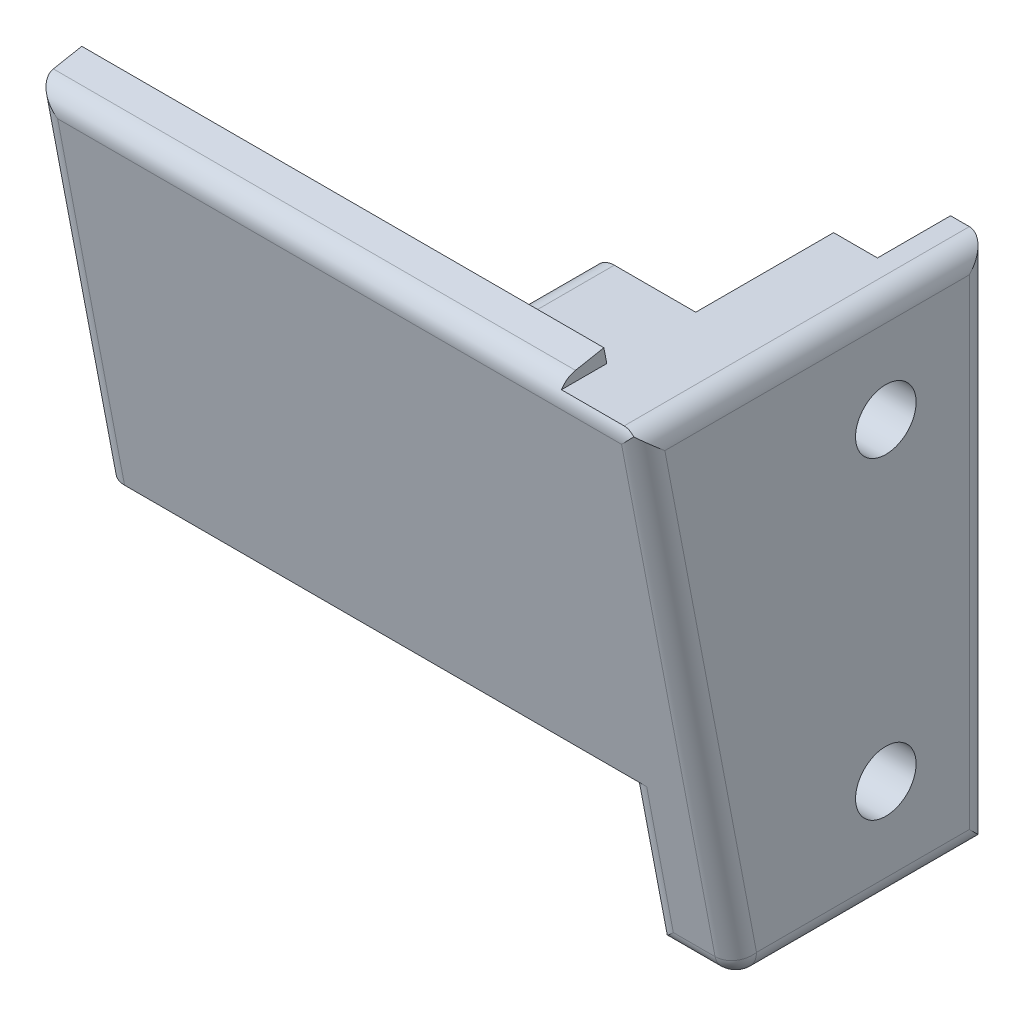
from build123d import *

# Parameters (mm, degrees)
EXTRUDE_1_DEPTH      = 50
SKETCH_2_W           = 50
SKETCH_2_H           = 10
EXTRUDE_2_DEPTH      = 10
SKETCH_3_W           = 10
SKETCH_3_H           = 20
EXTRUDE_3_DEPTH      = 20
SKETCH_4_W           = 20
SKETCH_4_H           = 10
EXTRUDE_4_DEPTH      = 30
CUT_EXTRUDE_1_DEPTH  = 50
CHAMFER_1_SIZE       = 2
SKETCH_9_R           = 1.5
CUT_EXTRUDE_2_DEPTH  = 66.715656955
CUT_EXTRUDE_4_DEPTH  = 6
SKETCH_13_W          = 4
SKETCH_13_H          = 6
EXTRUDE_12_DEPTH     = 18.003980276
SKETCH_15_W          = 20
SKETCH_15_H          = 50
SKETCH_15_R          = 1.5
EXTRUDE_14_DEPTH     = 4
CUT_EXTRUDE_5_DEPTH  = 4
SKETCH_17_W          = 20
SKETCH_17_H          = 20
EXTRUDE_15_DEPTH     = 6
SKETCH_18_W          = 50
SKETCH_18_H          = 4
CUT_EXTRUDE_6_DEPTH  = 20
SKETCH_19_W          = 4
SKETCH_19_H          = 4
CUT_EXTRUDE_9_DEPTH  = 18.003980276
EXTRUDE_16_REACH     = 84.488
SKETCH_20_W          = 5
SKETCH_20_H          = 30
EXTRUDE_17_DEPTH     = 18.003980276
SKETCH_22_W          = 60
SKETCH_22_H          = 10
CUT_EXTRUDE_10_DEPTH = 6
SKETCH_23_R          = 1.5
CUT_EXTRUDE_11_DEPTH = 4
CHAMFER_2_SIZE       = 1
SKETCH_24_R          = 3
CUT_EXTRUDE_12_DEPTH = 2
SKETCH_25_W          = 15
SKETCH_25_H          = 50
CUT_EXTRUDE_13_DEPTH = 10
SKETCH_26_W          = 5
SKETCH_26_H          = 50
EXTRUDE_18_DEPTH     = 19
SKETCH_27_W          = 7
SKETCH_27_H          = 50
CUT_EXTRUDE_14_DEPTH = 4.2
EXTRUDE_19_DEPTH     = 3
SKETCH_29_R          = 1.5
CUT_EXTRUDE_15_DEPTH = 13
SKETCH_30_R          = 2.9
CUT_EXTRUDE_16_DEPTH = 6
SKETCH_31_W          = 6
SKETCH_31_H          = 10
CUT_EXTRUDE_17_DEPTH = 10
SKETCH_32_W          = 8
SKETCH_32_H          = 10
EXTRUDE_20_DEPTH     = 6
SKETCH_33_W          = 50
SKETCH_33_H          = 5
CUT_EXTRUDE_18_DEPTH = 6
EXTRUDE_21_REACH     = 80.899
SKETCH_34_W          = 9.8
SKETCH_34_H          = 8.8
CUT_EXTRUDE_19_DEPTH = 3
SKETCH_36_W          = 58
SKETCH_36_H          = 4.873682846
CUT_EXTRUDE_20_DEPTH = 24
SKETCH_37_W          = 8
SKETCH_37_H          = 3
CUT_EXTRUDE_21_DEPTH = 24
FILLET_1_R           = 2
FILLET_2_R           = 2
FILLET_3_R           = 5


with BuildPart() as part:
    # 草图1 → 凸台-拉伸1 (new body)
    with BuildSketch(Plane(origin=(0, 0, 0), x_dir=(0, 0, -1), z_dir=(1, 0, 0))):
        Polygon((0, 0), (-10, 0), (-17.629858184, 40), (-10, 41.455368398), (-4, 10), (0, 10), align=None)
    extrude(amount=EXTRUDE_1_DEPTH)

    # 草图2 → 凸台-拉伸2 (add)
    with BuildSketch(Plane.XZ):
        with Locations((25, 5)):
            Rectangle(SKETCH_2_W, SKETCH_2_H)
    extrude(amount=EXTRUDE_2_DEPTH)

    # 草图3 → 凸台-拉伸3 (add)
    with BuildSketch(Plane.ZY):
        with Locations((5, 0)):
            Rectangle(SKETCH_3_W, SKETCH_3_H)
    extrude(amount=EXTRUDE_3_DEPTH)

    # 草图4 → 凸台-拉伸4 (add)
    with BuildSketch(Plane(origin=(0, 10, 0), x_dir=(1, 0, 0), z_dir=(0, 1, 0))):
        with Locations((-10, -5)):
            Rectangle(SKETCH_4_W, SKETCH_4_H)
    extrude(amount=EXTRUDE_4_DEPTH)

    # 草图5 → 切除-拉伸1 (cut)
    with BuildSketch(Plane(origin=(50, 0, 0), x_dir=(0, 0, -1), z_dir=(1, 0, 0))):
        Polygon((-10, 10.003980276), (-11.908223769, 10.003980276), (-10, 0), align=None)
    extrude(amount=-CUT_EXTRUDE_1_DEPTH, mode=Mode.SUBTRACT)

    # 倒角1
    # the kernel refuses this chamfer: 2 mm, written as the material it adds along each edge
    with BuildSketch(Plane(origin=(50, 10.003980276, 10), x_dir=(0, 0.027495876610586487, 0.9996219169112968), z_dir=(-1, 0, 0))) as chamfer_1_piece_1_section:
        Polygon((CHAMFER_1_SIZE * 0.999621916911, -CHAMFER_1_SIZE * 0.0274958766106), (-CHAMFER_1_SIZE * 0.0274958766106, -CHAMFER_1_SIZE * 0.999621916911), (0, 0), align=None)
    chamfer_1_piece_1 = extrude(amount=50, mode=Mode.PRIVATE)
    chamfer_1_piece_1 = split(chamfer_1_piece_1, bisect_by=Plane(origin=(25, 9.131023425, 11.741710345), z_dir=(0, 0.18736828457892524, -0.9822897362458548)), keep=Keep.TOP, mode=Mode.PRIVATE)
    add(chamfer_1_piece_1)

    # 草图9 → 切除-拉伸2 (cut, through all)
    with BuildSketch(Plane.XY.offset(10)):
        with Locations((-10, 30)):
            Circle(SKETCH_9_R)
        with Locations((-10, 0)):
            Circle(SKETCH_9_R)
    extrude(amount=-CUT_EXTRUDE_2_DEPTH, mode=Mode.SUBTRACT)

    # 草图12 → 切除-拉伸4 (cut)
    with BuildSketch(Plane.XY.offset(10)):
        Polygon((50, -10), (50, 8.003980276), (0, 8.003980276), (0, 40), (-20, 40), (-20, -10), align=None)
    extrude(amount=-CUT_EXTRUDE_4_DEPTH, mode=Mode.SUBTRACT)

    # 草图13 → 凸台-拉伸12 (add)
    with BuildSketch(Plane.XZ.offset(-8.003980276)):
        with Locations((2, 7)):
            Rectangle(SKETCH_13_W, SKETCH_13_H)
        with Locations((48, 7)):
            Rectangle(SKETCH_13_W, SKETCH_13_H)
    extrude(amount=EXTRUDE_12_DEPTH)

    # 草图15 → 凸台-拉伸14 (add)
    with BuildSketch(Plane(origin=(0, 0, 0), x_dir=(-1, 0, 0), z_dir=(0, 0, -1))):
        with Locations((-60, 15)):
            Rectangle(SKETCH_15_W, SKETCH_15_H)
        with Locations(Location((-60, 30, 0), (0, 0, 180))):
            Circle(SKETCH_15_R, mode=Mode.SUBTRACT)
    extrude(amount=-EXTRUDE_14_DEPTH)

    # 草图16 → 切除-拉伸5 (cut)
    with BuildSketch(Plane.XY.offset(4)):
        Polygon((-20, -10), (0, -10), (0, 10), (0, 40), (-20, 40), align=None)
    extrude(amount=-CUT_EXTRUDE_5_DEPTH, mode=Mode.SUBTRACT)

    # 草图17 → 凸台-拉伸15 (add)
    with BuildSketch(Plane.XY.offset(4)):
        with Locations((60, 0)):
            Rectangle(SKETCH_17_W, SKETCH_17_H)
    extrude(amount=EXTRUDE_15_DEPTH)

    # 草图18 → 切除-拉伸6 (cut)
    with BuildSketch(Plane(origin=(0, 10, 0), x_dir=(1, 0, 0), z_dir=(0, 1, 0))):
        with Locations((25, -2)):
            Rectangle(SKETCH_18_W, SKETCH_18_H)
    extrude(amount=-CUT_EXTRUDE_6_DEPTH, mode=Mode.SUBTRACT)

    # 草图19 → 切除-拉伸9 (cut)
    with BuildSketch(Plane.XZ.offset(10)):
        with Locations((48, 8)):
            Rectangle(SKETCH_19_W, SKETCH_19_H)
        with Locations((2, 8)):
            Rectangle(SKETCH_19_W, SKETCH_19_H)
    extrude(amount=-CUT_EXTRUDE_9_DEPTH, mode=Mode.SUBTRACT)

    # 凸台-拉伸16: up to this plane
    extrude_16_end = Plane(origin=(50, 0, 10), z_dir=(0, 0.18736828457892524, -0.9822897362458548))
    # 草图20 → 凸台-拉伸16 (add, up to the surface)
    with BuildSketch(Plane.XY.offset(4), mode=Mode.PRIVATE) as extrude_16_sk1:
        with Locations((52.5, 25)):
            Rectangle(SKETCH_20_W, SKETCH_20_H)
    extrude_16_tool1 = split(extrude(extrude_16_sk1.sketch, amount=EXTRUDE_16_REACH, mode=Mode.PRIVATE), bisect_by=extrude_16_end, keep=Keep.BOTH, mode=Mode.PRIVATE)
    add(extrude_16_tool1.solids().sort_by_distance((52.5, 25, 4))[0])

    # 草图21 → 凸台-拉伸17 (add)
    with BuildSketch(Plane.XZ.offset(-8.003980276)):
        Polygon((50, 6), (50, 10), (0, 10), (0, 6), (4, 6), (4, 4), (46, 4), (46, 6), align=None)
    extrude(amount=EXTRUDE_17_DEPTH)

    # 草图22 → 切除-拉伸10 (cut)
    with BuildSketch(Plane.XY.offset(10)):
        with Locations((40, 0)):
            Rectangle(SKETCH_22_W, SKETCH_22_H)
    extrude(amount=-CUT_EXTRUDE_10_DEPTH, mode=Mode.SUBTRACT)

    # 草图23 → 切除-拉伸11 (cut)
    with BuildSketch(Plane(origin=(0, 0, 0), x_dir=(-1, 0, 0), z_dir=(0, 0, -1))):
        with Locations((-60, 0)):
            Circle(SKETCH_23_R)
    extrude(amount=-CUT_EXTRUDE_11_DEPTH, mode=Mode.SUBTRACT)

    # 倒角2
    chamfer_2_edges = [part.edges().sort_by_distance(p)[0] for p in [
        (52.5, 10, 10),
    ]]
    chamfer(chamfer_2_edges, length=CHAMFER_2_SIZE)

    # 草图24 → 切除-拉伸12 (cut)
    with BuildSketch(Plane.XY.offset(4)):
        with Locations((60, 30)):
            Circle(SKETCH_24_R)
        with Locations((60, 0)):
            Circle(SKETCH_24_R)
    extrude(amount=-CUT_EXTRUDE_12_DEPTH, mode=Mode.SUBTRACT)

    # 草图25 → 切除-拉伸13 (cut)
    with BuildSketch(Plane.XY.offset(10)):
        with Locations((62.5, 15)):
            Rectangle(SKETCH_25_W, SKETCH_25_H)
    extrude(amount=-CUT_EXTRUDE_13_DEPTH, mode=Mode.SUBTRACT)

    # 草图26 → 凸台-拉伸18 (add)
    with BuildSketch(Plane(origin=(0, 0, 0), x_dir=(-1, 0, 0), z_dir=(0, 0, -1))):
        with Locations((-52.5, 15)):
            Rectangle(SKETCH_26_W, SKETCH_26_H)
    extrude(amount=EXTRUDE_18_DEPTH)

    # 草图27 → 切除-拉伸14 (cut)
    with BuildSketch(Plane.ZY.offset(-50)):
        with Locations((-15.5, 15)):
            Rectangle(SKETCH_27_W, SKETCH_27_H)
    extrude(amount=-CUT_EXTRUDE_14_DEPTH, mode=Mode.SUBTRACT)

    # 草图28 → 凸台-拉伸19 (add)
    with BuildSketch(Plane(origin=(55, 0, 0), x_dir=(0, 0, -1), z_dir=(1, 0, 0))):
        Polygon((-10, -5), (-10, -10), (19, -10), (19, 40), (-17.629858184, 40), (-11.907464546, 10), (-11, 10), (-10, 9), (-10, 5), (-4, 5), (-4, -5), align=None)
    extrude(amount=EXTRUDE_19_DEPTH)

    # 草图29 → 切除-拉伸15 (cut)
    with BuildSketch(Plane(origin=(58, 0, 0), x_dir=(0, 0, -1), z_dir=(1, 0, 0))):
        with Locations((9, 30)):
            Circle(SKETCH_29_R)
        with Locations((9, 0)):
            Circle(SKETCH_29_R)
    extrude(amount=-CUT_EXTRUDE_15_DEPTH, mode=Mode.SUBTRACT)

    # 草图30 → 切除-拉伸16 (cut)
    with BuildSketch(Plane(origin=(58, 0, 0), x_dir=(0, 0, -1), z_dir=(1, 0, 0))):
        with Locations((9, 30)):
            Circle(SKETCH_30_R)
        with Locations((9, 0)):
            Circle(SKETCH_30_R)
    extrude(amount=-CUT_EXTRUDE_16_DEPTH, mode=Mode.SUBTRACT)

    # 草图31 → 切除-拉伸17 (cut)
    with BuildSketch(Plane(origin=(10, 0, 0), x_dir=(0, 0, -1), z_dir=(1, 0, 0))):
        with Locations((-7, 0)):
            Rectangle(SKETCH_31_W, SKETCH_31_H)
    extrude(amount=-CUT_EXTRUDE_17_DEPTH, mode=Mode.SUBTRACT)

    # 草图32 → 凸台-拉伸20 (add)
    with BuildSketch(Plane.XY.offset(4)):
        with Locations((54, 0)):
            Rectangle(SKETCH_32_W, SKETCH_32_H)
    extrude(amount=EXTRUDE_20_DEPTH)

    # 草图33 → 切除-拉伸18 (cut)
    with BuildSketch(Plane.XY.offset(10)):
        with Locations((25, -7.5)):
            Rectangle(SKETCH_33_W, SKETCH_33_H)
    extrude(amount=-CUT_EXTRUDE_18_DEPTH, mode=Mode.SUBTRACT)

    # 凸台-拉伸21: up to this face of the body (flat: up to its plane)
    extrude_21_end = Plane(part.part.faces().sort_by_distance((25, 5, 7))[0])
    # 草图34 → 凸台-拉伸21 (add, up to the picked face)
    with BuildSketch(Plane(origin=(0, 40, 0), x_dir=(1, 0, 0), z_dir=(0, 1, 0)), mode=Mode.PRIVATE) as extrude_21_sk1:
        with Locations((45.1, -5.6)):
            Rectangle(SKETCH_34_W, SKETCH_34_H)
    extrude_21_tool1 = split(extrude(extrude_21_sk1.sketch, amount=-EXTRUDE_21_REACH, mode=Mode.PRIVATE), bisect_by=extrude_21_end, keep=Keep.BOTH, mode=Mode.PRIVATE)
    add(extrude_21_tool1.solids().sort_by(Axis((45.1, 40, 5.6), (0, -1, 0)))[0])

    # 草图35 → 切除-拉伸19 (cut)
    with BuildSketch(Plane(origin=(0, -1.840499428, 9.648931259), x_dir=(1, 0, 0), z_dir=(0, -0.18736828457892524, 0.9822897362458548))):
        Polygon((0, 42.594865735), (0, 11.9425774), (50, 11.9425774), (50, 12.053978568), (58, 12.053978568), (58, 42.594865735), (50, 42.594865735), align=None)
    extrude(amount=-CUT_EXTRUDE_19_DEPTH, mode=Mode.SUBTRACT)

    # 草图36 → 切除-拉伸20 (cut)
    with BuildSketch(Plane(origin=(0, 11.731071204, 2.237660241), x_dir=(1, 0, 0), z_dir=(0, 0.9822897362458547, 0.18736828457892518))):
        with Locations((29, -9.259738785)):
            Rectangle(SKETCH_36_W, SKETCH_36_H)
    extrude(amount=-CUT_EXTRUDE_20_DEPTH, mode=Mode.SUBTRACT)

    # 草图37 → 切除-拉伸21 (cut)
    with BuildSketch(Plane(origin=(0, 11.840499428, 2.258533287), x_dir=(1, 0, 0), z_dir=(0, 0.9822897362458547, 0.18736828457892518))):
        with Locations((54, -8.322897362)):
            Rectangle(SKETCH_37_W, SKETCH_37_H)
    extrude(amount=-CUT_EXTRUDE_21_DEPTH, mode=Mode.SUBTRACT)

    # 圆角1
    fillet_1_edges = [part.edges().sort_by_distance(p)[0] for p in [
        (40.2, 40, 5.461196819),
        (40.2, 5, 2.6),
    ]]
    fillet(fillet_1_edges, radius=FILLET_1_R)

    # 圆角2
    # the kernel refuses this fillet: 2 mm, written as the material it takes off along each edge
    with BuildSketch(Plane(origin=(56, -8, 3.383880502), x_dir=(0, -1, 0), z_dir=(1, 0, 0))) as fillet_2_piece_1_section:
        Polygon((0, 0), (FILLET_2_R * 1.02, 0), (FILLET_2_R * 1.02, -FILLET_2_R * 0.843828779986), (FILLET_2_R * 0.191115650271, -FILLET_2_R * 1.00193553097), align=None)
    fillet_2_piece_1 = extrude(amount=FILLET_2_R * 1.02, mode=Mode.PRIVATE)
    fillet_2_piece_1 = fillet_2_piece_1 - Plane(origin=(56, -8, 3.383880502), x_dir=(0, 0.7705090150604746, -0.637429100144116), z_dir=(1, 0, 0)) * Sphere(FILLET_2_R, mode=Mode.PRIVATE)
    add(fillet_2_piece_1, mode=Mode.SUBTRACT)
    with BuildSketch(Plane(origin=(50, -21.787476835, 2.790027322), x_dir=(0, 0.1873682845789252, -0.9822897362458548), z_dir=(0, 0.9822897362458548, 0.1873682845789252))) as fillet_2_piece_2_section:
        with BuildLine():
            CenterArc((FILLET_2_R, -FILLET_2_R), FILLET_2_R, 90, 90)
            Line((0, -FILLET_2_R), (-FILLET_2_R * 0.02, -FILLET_2_R))
            Line((-FILLET_2_R * 0.02, -FILLET_2_R), (-FILLET_2_R * 0.02, FILLET_2_R * 0.02))
            Line((-FILLET_2_R * 0.02, FILLET_2_R * 0.02), (FILLET_2_R, FILLET_2_R * 0.02))
            Line((FILLET_2_R, FILLET_2_R * 0.02), (FILLET_2_R, 0))
        make_face()
    fillet_2_piece_2 = extrude(amount=39.270443584, mode=Mode.PRIVATE)
    fillet_2_piece_2 = split(fillet_2_piece_2, bisect_by=Plane(origin=(50.453560867, 5, 4.893277607), z_dir=(0, -1, 0)), keep=Keep.TOP, mode=Mode.PRIVATE)
    add(fillet_2_piece_2, mode=Mode.SUBTRACT)
    with BuildSketch(Plane(origin=(56, -10, 5.038446737), x_dir=(0, 0, -1), z_dir=(-1, 0, 0))) as fillet_2_piece_3:
        with BuildLine():
            CenterArc((FILLET_2_R * 0.827283117634, -FILLET_2_R), FILLET_2_R, 90, 79.200760026)
            Line((-FILLET_2_R * 0.155006618612, -FILLET_2_R * 0.812631715421), (-FILLET_2_R * 0.174652413337, -FILLET_2_R * 0.808884349729))
            Line((-FILLET_2_R * 0.174652413337, -FILLET_2_R * 0.808884349729), (-FILLET_2_R * 0.0165456623527, FILLET_2_R * 0.02))
            Line((-FILLET_2_R * 0.0165456623527, FILLET_2_R * 0.02), (FILLET_2_R * 0.827283117634, FILLET_2_R * 0.02))
            Line((FILLET_2_R * 0.827283117634, FILLET_2_R * 0.02), (FILLET_2_R * 0.827283117634, 0))
        make_face()
    extrude(amount=15.927397412, mode=Mode.SUBTRACT)
    with BuildSketch(Plane(origin=(58, -8.374736569, 5.348459975), x_dir=(3.552713678800502e-15, 0.18736828457892515, -0.9822897362458548), z_dir=(0, 0.9822897362458548, 0.18736828457892515))) as fillet_2_piece_4:
        with BuildLine():
            CenterArc((FILLET_2_R, FILLET_2_R), FILLET_2_R, 180, 90)
            Line((0, FILLET_2_R), (-FILLET_2_R * 0.02, FILLET_2_R))
            Line((-FILLET_2_R * 0.02, FILLET_2_R), (-FILLET_2_R * 0.02, -FILLET_2_R * 0.02))
            Line((-FILLET_2_R * 0.02, -FILLET_2_R * 0.02), (FILLET_2_R, -FILLET_2_R * 0.02))
            Line((FILLET_2_R, -FILLET_2_R * 0.02), (FILLET_2_R, 0))
        make_face()
    extrude(amount=61.246912376, mode=Mode.SUBTRACT)
    with BuildSketch(Plane(origin=(58, 40, -31), x_dir=(-1, 0, 0), z_dir=(0, 0, 1))) as fillet_2_piece_5:
        with BuildLine():
            CenterArc((FILLET_2_R, FILLET_2_R), FILLET_2_R, 180, 90)
            Line((0, FILLET_2_R), (-FILLET_2_R * 0.02, FILLET_2_R))
            Line((-FILLET_2_R * 0.02, FILLET_2_R), (-FILLET_2_R * 0.02, -FILLET_2_R * 0.02))
            Line((-FILLET_2_R * 0.02, -FILLET_2_R * 0.02), (FILLET_2_R, -FILLET_2_R * 0.02))
            Line((FILLET_2_R, -FILLET_2_R * 0.02), (FILLET_2_R, 0))
        make_face()
    extrude(amount=57.575769467, mode=Mode.SUBTRACT)
    with BuildSketch(Plane(origin=(58, -10, 3.383880502), x_dir=(-1, 0, 0), z_dir=(0, 0, -1))) as fillet_2_piece_6:
        with BuildLine():
            CenterArc((FILLET_2_R, FILLET_2_R), FILLET_2_R, 180, 90)
            Line((0, FILLET_2_R), (-FILLET_2_R * 0.02, FILLET_2_R))
            Line((-FILLET_2_R * 0.02, FILLET_2_R), (-FILLET_2_R * 0.02, -FILLET_2_R * 0.02))
            Line((-FILLET_2_R * 0.02, -FILLET_2_R * 0.02), (FILLET_2_R, -FILLET_2_R * 0.02))
            Line((FILLET_2_R, -FILLET_2_R * 0.02), (FILLET_2_R, 0))
        make_face()
    extrude(amount=34.383880502, mode=Mode.SUBTRACT)
    with BuildSketch(Plane(origin=(58, -22, -19), x_dir=(-1, 0, 0), z_dir=(0, 1, 0)), Plane(origin=(62, 40.562104854, 14.682988975), x_dir=(0, 0.1873682845789233, -0.9822897362458551), z_dir=(-1, 0, 0))) as fillet_2_piece_7:
        with BuildLine():
            CenterArc((FILLET_2_R, FILLET_2_R), FILLET_2_R, 180, 90)
            Line((0, FILLET_2_R), (-FILLET_2_R * 0.02, FILLET_2_R))
            Line((-FILLET_2_R * 0.02, FILLET_2_R), (-FILLET_2_R * 0.02, -FILLET_2_R * 0.02))
            Line((-FILLET_2_R * 0.02, -FILLET_2_R * 0.02), (FILLET_2_R, -FILLET_2_R * 0.02))
            Line((FILLET_2_R, -FILLET_2_R * 0.02), (FILLET_2_R, 0))
        make_face()
    extrude(amount=74, mode=Mode.SUBTRACT)
    with BuildSketch(Plane(origin=(0, 52.349581689, 16.93140839), x_dir=(0, 0.18736828457892515, -0.9822897362458548), z_dir=(0, -0.9822897362458548, -0.18736828457892515))) as fillet_2_piece_8:
        with BuildLine():
            CenterArc((FILLET_2_R, FILLET_2_R), FILLET_2_R, 180, 90)
            Line((0, FILLET_2_R), (-FILLET_2_R * 0.02, FILLET_2_R))
            Line((-FILLET_2_R * 0.02, FILLET_2_R), (-FILLET_2_R * 0.02, -FILLET_2_R * 0.02))
            Line((-FILLET_2_R * 0.02, -FILLET_2_R * 0.02), (FILLET_2_R, -FILLET_2_R * 0.02))
            Line((FILLET_2_R, -FILLET_2_R * 0.02), (FILLET_2_R, 0))
        make_face()
    extrude(amount=60.203274392, mode=Mode.SUBTRACT)

    # 圆角3
    fillet_3_edges = [part.edges().sort_by_distance(p)[0] for p in [
        (20.1, 10, 4),
    ]]
    fillet(fillet_3_edges, radius=FILLET_3_R)


solid = part.part
